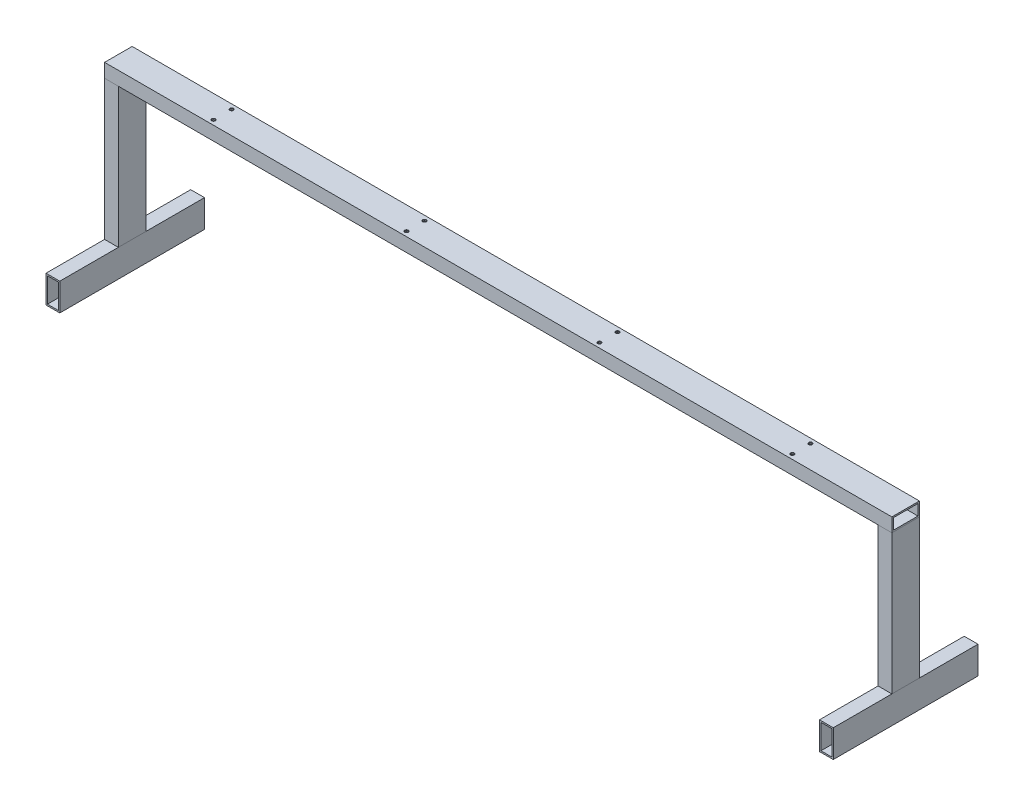
from build123d import *

# Parameters (mm, degrees)
AL_START                                       = -544.05
AL_TUBE_RECTANGULAR_AL_TUBE_3_X_1_5_2_W        = 192.85
AL_TUBE_RECTANGULAR_AL_TUBE_3_X_1_5_2_H        = 38.1
AL_TUBE_RECTANGULAR_AL_TUBE_3_X_1_5_RECT_DEPTH = 2.032
AL_START_2                                     = -527.032
AL_TUBE_RECTANGULAR_AL_TUBE_3_X_1_5_3_OU_W     = 192.85
AL_TUBE_RECTANGULAR_AL_TUBE_3_X_1_5_3_OU_H     = 38.1
AL_TUBE_RECTANGULAR_AL_TUBE_3_X_1_5_3_DEPTH    = 2.032
AL_START_3                                     = -542.018
AL_TUBE_RECTANGULAR_AL_TUBE_3_X_1_5_4_OU_W     = 192.85
AL_TUBE_RECTANGULAR_AL_TUBE_3_X_1_5_4_OU_H     = 2.032
AL_TUBE_RECTANGULAR_AL_TUBE_3_X_1_5_4_DEPTH    = 14.986
AL_START_4                                     = -19.05
AL_TUBE_RECTANGULAR_AL_TUBE_3_X_1_5_5_OU_W     = 1088.1
AL_TUBE_RECTANGULAR_AL_TUBE_3_X_1_5_5_OU_H     = 38.1
AL_TUBE_RECTANGULAR_AL_TUBE_3_X_1_5_5_DEPTH    = 2.032
AL_START_5                                     = -2.032
AL_TUBE_RECTANGULAR_AL_TUBE_3_X_1_5_6_OU_W     = 1088.1
AL_TUBE_RECTANGULAR_AL_TUBE_3_X_1_5_6_OU_H     = 38.1
AL_TUBE_RECTANGULAR_AL_TUBE_3_X_1_5_6_DEPTH    = 2.032
AL_START_6                                     = -17.018
AL_TUBE_RECTANGULAR_AL_TUBE_3_X_1_5_7_OU_W     = 1088.1
AL_TUBE_RECTANGULAR_AL_TUBE_3_X_1_5_7_OU_H     = 2.032
AL_TUBE_RECTANGULAR_AL_TUBE_3_X_1_5_7_DEPTH    = 14.986
AL_START_7                                     = 525
AL_TUBE_RECTANGULAR_AL_TUBE_3_X_1_5_8_OU_W     = 192.85
AL_TUBE_RECTANGULAR_AL_TUBE_3_X_1_5_8_OU_H     = 38.1
AL_TUBE_RECTANGULAR_AL_TUBE_3_X_1_5_8_DEPTH    = 2.032
AL_START_8                                     = 542.018
AL_TUBE_RECTANGULAR_AL_TUBE_3_X_1_5_9_OU_W     = 192.85
AL_TUBE_RECTANGULAR_AL_TUBE_3_X_1_5_9_OU_H     = 38.1
AL_TUBE_RECTANGULAR_AL_TUBE_3_X_1_5_9_DEPTH    = 2.032
AL_START_9                                     = 527.032
AL_TUBE_RECTANGULAR_AL_TUBE_3_X_1_5_10_O_W     = 192.85
AL_TUBE_RECTANGULAR_AL_TUBE_3_X_1_5_10_O_H     = 2.032
AL_TUBE_RECTANGULAR_AL_TUBE_3_X_1_5_10_DEPTH   = 14.986
AL_TUBE_RECTANGULAR_AL_TUBE_3_X_1_5_11_O_W     = 38.1
AL_TUBE_RECTANGULAR_AL_TUBE_3_X_1_5_11_O_H     = 200
AL_TUBE_RECTANGULAR_AL_TUBE_3_X_1_5_11_DEPTH   = 2.032
AL_TUBE_RECTANGULAR_AL_TUBE_3_X_1_5_12_O_W     = 38.1
AL_TUBE_RECTANGULAR_AL_TUBE_3_X_1_5_12_O_H     = 200
AL_TUBE_RECTANGULAR_AL_TUBE_3_X_1_5_12_DEPTH   = 2.032
AL_TUBE_RECTANGULAR_AL_TUBE_3_X_1_5_13_O_W     = 2.032
AL_TUBE_RECTANGULAR_AL_TUBE_3_X_1_5_13_O_H     = 200
AL_TUBE_RECTANGULAR_AL_TUBE_3_X_1_5_13_DEPTH   = 14.986
AL_TUBE_RECTANGULAR_AL_TUBE_3_X_1_5_14_O_W     = 38.1
AL_TUBE_RECTANGULAR_AL_TUBE_3_X_1_5_14_O_H     = 200
AL_TUBE_RECTANGULAR_AL_TUBE_3_X_1_5_14_DEPTH   = 2.032
AL_TUBE_RECTANGULAR_AL_TUBE_3_X_1_5_15_O_W     = 38.1
AL_TUBE_RECTANGULAR_AL_TUBE_3_X_1_5_15_O_H     = 200
AL_TUBE_RECTANGULAR_AL_TUBE_3_X_1_5_15_DEPTH   = 2.032
AL_TUBE_RECTANGULAR_AL_TUBE_3_X_1_5_16_O_W     = 2.032
AL_TUBE_RECTANGULAR_AL_TUBE_3_X_1_5_16_O_H     = 200
AL_TUBE_RECTANGULAR_AL_TUBE_3_X_1_5_16_DEPTH   = 14.986
TROU_TARAUD_M5X0_81_AT_2_COUNT                 = 2
TROU_TARAUD_M5X0_81_AT_2_PITCH                 = 800
TROU_TARAUD_M5X0_81_AT_3_COUNT                 = 2
TROU_TARAUD_M5X0_81_AT_3_PITCH                 = 800.390529679
TROU_TARAUD_M5X0_81_AT_4_COUNT                 = 2
TROU_TARAUD_M5X0_81_AT_4_PITCH                 = 533.918949321
TROU_TARAUD_M5X0_81_AT_5_COUNT                 = 2
TROU_TARAUD_M5X0_81_AT_5_PITCH                 = 533.333333333
TROU_TARAUD_M5X0_81_AT_6_COUNT                 = 2
TROU_TARAUD_M5X0_81_AT_6_PITCH                 = 266.666666667
TROU_TARAUD_M5X0_81_AT_7_COUNT                 = 2
TROU_TARAUD_M5X0_81_AT_7_PITCH                 = 267.835978
TROU_TARAUD_M5X0_81_AT_8_COUNT                 = 2
TROU_TARAUD_M5X0_81_AT_8_PITCH                 = 25


# Read off the part's stored shape, not the designer's step: Al tube rectangular AL TUBE 3 X 1.5 RECT X 0.104 WALL(4)
with BuildPart() as part:
    # Al tube rectangular AL TUBE 3 X 1.5  2 → Al tube rectangular AL TUBE 3 X 1.5 RECT X 0.104 WALL(4) (new body)
    with BuildSketch(Plane.YZ.offset(AL_START)):
        with Locations((-115.475, 0)):
            Rectangle(AL_TUBE_RECTANGULAR_AL_TUBE_3_X_1_5_2_W, AL_TUBE_RECTANGULAR_AL_TUBE_3_X_1_5_2_H)
    extrude(amount=AL_TUBE_RECTANGULAR_AL_TUBE_3_X_1_5_RECT_DEPTH)

    # Al tube rectangular AL TUBE 3 X 1.5 3 ou → Al tube rectangular AL TUBE 3 X 1.5  3 (add)
    with BuildSketch(Plane.YZ.offset(AL_START_2)):
        with Locations((-115.475, 0)):
            Rectangle(AL_TUBE_RECTANGULAR_AL_TUBE_3_X_1_5_3_OU_W, AL_TUBE_RECTANGULAR_AL_TUBE_3_X_1_5_3_OU_H)
    extrude(amount=AL_TUBE_RECTANGULAR_AL_TUBE_3_X_1_5_3_DEPTH)

    # Al tube rectangular AL TUBE 3 X 1.5 4 ou → Al tube rectangular AL TUBE 3 X 1.5  4 (add)
    with BuildSketch(Plane.YZ.offset(AL_START_3)):
        with Locations((-115.475, 18.034)):
            Rectangle(AL_TUBE_RECTANGULAR_AL_TUBE_3_X_1_5_4_OU_W, AL_TUBE_RECTANGULAR_AL_TUBE_3_X_1_5_4_OU_H)
        with Locations((-115.475, -18.034)):
            Rectangle(AL_TUBE_RECTANGULAR_AL_TUBE_3_X_1_5_4_OU_W, AL_TUBE_RECTANGULAR_AL_TUBE_3_X_1_5_4_OU_H)
    extrude(amount=AL_TUBE_RECTANGULAR_AL_TUBE_3_X_1_5_4_DEPTH)


with BuildPart() as body_2:
    # Al tube rectangular AL TUBE 3 X 1.5 5 ou → Al tube rectangular AL TUBE 3 X 1.5  5 (new body)
    with BuildSketch(Plane(origin=(0, 0, 0), x_dir=(1, 0, 0), z_dir=(0, 1, 0)).offset(AL_START_4)):
        Rectangle(AL_TUBE_RECTANGULAR_AL_TUBE_3_X_1_5_5_OU_W, AL_TUBE_RECTANGULAR_AL_TUBE_3_X_1_5_5_OU_H)
    extrude(amount=AL_TUBE_RECTANGULAR_AL_TUBE_3_X_1_5_5_DEPTH)

    # Al tube rectangular AL TUBE 3 X 1.5 6 ou → Al tube rectangular AL TUBE 3 X 1.5  6 (add)
    with BuildSketch(Plane(origin=(0, 0, 0), x_dir=(1, 0, 0), z_dir=(0, 1, 0)).offset(AL_START_5)):
        Rectangle(AL_TUBE_RECTANGULAR_AL_TUBE_3_X_1_5_6_OU_W, AL_TUBE_RECTANGULAR_AL_TUBE_3_X_1_5_6_OU_H)
    extrude(amount=AL_TUBE_RECTANGULAR_AL_TUBE_3_X_1_5_6_DEPTH)

    # Al tube rectangular AL TUBE 3 X 1.5 7 ou → Al tube rectangular AL TUBE 3 X 1.5  7 (add)
    with BuildSketch(Plane(origin=(0, 0, 0), x_dir=(1, 0, 0), z_dir=(0, 1, 0)).offset(AL_START_6)):
        with Locations((0, 18.034)):
            Rectangle(AL_TUBE_RECTANGULAR_AL_TUBE_3_X_1_5_7_OU_W, AL_TUBE_RECTANGULAR_AL_TUBE_3_X_1_5_7_OU_H)
        with Locations((0, -18.034)):
            Rectangle(AL_TUBE_RECTANGULAR_AL_TUBE_3_X_1_5_7_OU_W, AL_TUBE_RECTANGULAR_AL_TUBE_3_X_1_5_7_OU_H)
    extrude(amount=AL_TUBE_RECTANGULAR_AL_TUBE_3_X_1_5_7_DEPTH)

    # Esquisse2 → Trou taraudé M5x0.81 (revolve, cut)
    with BuildSketch(Plane(origin=(400, 0, -12.5), x_dir=(0, 0, 1), z_dir=(1, 0, 0))):
        Polygon((0, 0), (0, 2.033), (2.1, 2.033), (2.1, 0.425), (2.525, 0), align=None)
    trou_taraud_m5x0_81 = revolve(axis=Axis((400, 6.35, -12.5), (0, -1, 0)), mode=Mode.SUBTRACT)

    # Trou taraudé M5x0.81 at 2: Trou taraudé M5x0.81 ×2
    with Locations(*[(-i * TROU_TARAUD_M5X0_81_AT_2_PITCH, 0, 0) for i in range(1, TROU_TARAUD_M5X0_81_AT_2_COUNT)]):
        add(trou_taraud_m5x0_81, mode=Mode.SUBTRACT)

    # Trou taraudé M5x0.81 at 3: Trou taraudé M5x0.81 ×2
    with Locations(*[Vector(-0.9995120760870788, 0, 0.031234752377721213) * (i * TROU_TARAUD_M5X0_81_AT_3_PITCH) for i in range(1, TROU_TARAUD_M5X0_81_AT_3_COUNT)]):
        add(trou_taraud_m5x0_81, mode=Mode.SUBTRACT)

    # Trou taraudé M5x0.81 at 4: Trou taraudé M5x0.81 ×2
    with Locations(*[Vector(-0.998903174369838, 0, 0.04682358629858615) * (i * TROU_TARAUD_M5X0_81_AT_4_PITCH) for i in range(1, TROU_TARAUD_M5X0_81_AT_4_COUNT)]):
        add(trou_taraud_m5x0_81, mode=Mode.SUBTRACT)

    # Trou taraudé M5x0.81 at 5: Trou taraudé M5x0.81 ×2
    with Locations(*[(-i * TROU_TARAUD_M5X0_81_AT_5_PITCH, 0, 0) for i in range(1, TROU_TARAUD_M5X0_81_AT_5_COUNT)]):
        add(trou_taraud_m5x0_81, mode=Mode.SUBTRACT)

    # Trou taraudé M5x0.81 at 6: Trou taraudé M5x0.81 ×2
    with Locations(*[(-i * TROU_TARAUD_M5X0_81_AT_6_PITCH, 0, 0) for i in range(1, TROU_TARAUD_M5X0_81_AT_6_COUNT)]):
        add(trou_taraud_m5x0_81, mode=Mode.SUBTRACT)

    # Trou taraudé M5x0.81 at 7: Trou taraudé M5x0.81 ×2
    with Locations(*[Vector(-0.9956342260592882, 0, 0.09334070869305829) * (i * TROU_TARAUD_M5X0_81_AT_7_PITCH) for i in range(1, TROU_TARAUD_M5X0_81_AT_7_COUNT)]):
        add(trou_taraud_m5x0_81, mode=Mode.SUBTRACT)

    # Trou taraudé M5x0.81 at 8: Trou taraudé M5x0.81 ×2
    with Locations(*[(0, 0, i * TROU_TARAUD_M5X0_81_AT_8_PITCH) for i in range(1, TROU_TARAUD_M5X0_81_AT_8_COUNT)]):
        add(trou_taraud_m5x0_81, mode=Mode.SUBTRACT)


with BuildPart() as body_3:
    # Al tube rectangular AL TUBE 3 X 1.5 8 ou → Al tube rectangular AL TUBE 3 X 1.5  8 (new body)
    with BuildSketch(Plane.YZ.offset(AL_START_7)):
        with Locations((-115.475, 0)):
            Rectangle(AL_TUBE_RECTANGULAR_AL_TUBE_3_X_1_5_8_OU_W, AL_TUBE_RECTANGULAR_AL_TUBE_3_X_1_5_8_OU_H)
    extrude(amount=AL_TUBE_RECTANGULAR_AL_TUBE_3_X_1_5_8_DEPTH)

    # Al tube rectangular AL TUBE 3 X 1.5 9 ou → Al tube rectangular AL TUBE 3 X 1.5  9 (add)
    with BuildSketch(Plane.YZ.offset(AL_START_8)):
        with Locations((-115.475, 0)):
            Rectangle(AL_TUBE_RECTANGULAR_AL_TUBE_3_X_1_5_9_OU_W, AL_TUBE_RECTANGULAR_AL_TUBE_3_X_1_5_9_OU_H)
    extrude(amount=AL_TUBE_RECTANGULAR_AL_TUBE_3_X_1_5_9_DEPTH)

    # Al tube rectangular AL TUBE 3 X 1.5 10 o → Al tube rectangular AL TUBE 3 X 1.5  10 (add)
    with BuildSketch(Plane.YZ.offset(AL_START_9)):
        with Locations((-115.475, 18.034)):
            Rectangle(AL_TUBE_RECTANGULAR_AL_TUBE_3_X_1_5_10_O_W, AL_TUBE_RECTANGULAR_AL_TUBE_3_X_1_5_10_O_H)
        with Locations((-115.475, -18.034)):
            Rectangle(AL_TUBE_RECTANGULAR_AL_TUBE_3_X_1_5_10_O_W, AL_TUBE_RECTANGULAR_AL_TUBE_3_X_1_5_10_O_H)
    extrude(amount=AL_TUBE_RECTANGULAR_AL_TUBE_3_X_1_5_10_DEPTH)


with BuildPart() as body_4:
    # Al tube rectangular AL TUBE 3 X 1.5 11 o → Al tube rectangular AL TUBE 3 X 1.5  11 (new body)
    with BuildSketch(Plane.YZ.offset(AL_START_7)):
        with Locations((-230.95, 0)):
            Rectangle(AL_TUBE_RECTANGULAR_AL_TUBE_3_X_1_5_11_O_W, AL_TUBE_RECTANGULAR_AL_TUBE_3_X_1_5_11_O_H)
    extrude(amount=AL_TUBE_RECTANGULAR_AL_TUBE_3_X_1_5_11_DEPTH)

    # Al tube rectangular AL TUBE 3 X 1.5 12 o → Al tube rectangular AL TUBE 3 X 1.5  12 (add)
    with BuildSketch(Plane.YZ.offset(AL_START_8)):
        with Locations((-230.95, 0)):
            Rectangle(AL_TUBE_RECTANGULAR_AL_TUBE_3_X_1_5_12_O_W, AL_TUBE_RECTANGULAR_AL_TUBE_3_X_1_5_12_O_H)
    extrude(amount=AL_TUBE_RECTANGULAR_AL_TUBE_3_X_1_5_12_DEPTH)

    # Al tube rectangular AL TUBE 3 X 1.5 13 o → Al tube rectangular AL TUBE 3 X 1.5  13 (add)
    with BuildSketch(Plane.YZ.offset(AL_START_9)):
        with Locations((-248.984, 0)):
            Rectangle(AL_TUBE_RECTANGULAR_AL_TUBE_3_X_1_5_13_O_W, AL_TUBE_RECTANGULAR_AL_TUBE_3_X_1_5_13_O_H)
        with Locations((-212.916, 0)):
            Rectangle(AL_TUBE_RECTANGULAR_AL_TUBE_3_X_1_5_13_O_W, AL_TUBE_RECTANGULAR_AL_TUBE_3_X_1_5_13_O_H)
    extrude(amount=AL_TUBE_RECTANGULAR_AL_TUBE_3_X_1_5_13_DEPTH)


with BuildPart() as body_5:
    # Al tube rectangular AL TUBE 3 X 1.5 14 o → Al tube rectangular AL TUBE 3 X 1.5  14 (new body)
    with BuildSketch(Plane.YZ.offset(AL_START)):
        with Locations((-230.95, 0)):
            Rectangle(AL_TUBE_RECTANGULAR_AL_TUBE_3_X_1_5_14_O_W, AL_TUBE_RECTANGULAR_AL_TUBE_3_X_1_5_14_O_H)
    extrude(amount=AL_TUBE_RECTANGULAR_AL_TUBE_3_X_1_5_14_DEPTH)

    # Al tube rectangular AL TUBE 3 X 1.5 15 o → Al tube rectangular AL TUBE 3 X 1.5  15 (add)
    with BuildSketch(Plane.YZ.offset(AL_START_2)):
        with Locations((-230.95, 0)):
            Rectangle(AL_TUBE_RECTANGULAR_AL_TUBE_3_X_1_5_15_O_W, AL_TUBE_RECTANGULAR_AL_TUBE_3_X_1_5_15_O_H)
    extrude(amount=AL_TUBE_RECTANGULAR_AL_TUBE_3_X_1_5_15_DEPTH)

    # Al tube rectangular AL TUBE 3 X 1.5 16 o → Al tube rectangular AL TUBE 3 X 1.5  16 (add)
    with BuildSketch(Plane.YZ.offset(AL_START_3)):
        with Locations((-248.984, 0)):
            Rectangle(AL_TUBE_RECTANGULAR_AL_TUBE_3_X_1_5_16_O_W, AL_TUBE_RECTANGULAR_AL_TUBE_3_X_1_5_16_O_H)
        with Locations((-212.916, 0)):
            Rectangle(AL_TUBE_RECTANGULAR_AL_TUBE_3_X_1_5_16_O_W, AL_TUBE_RECTANGULAR_AL_TUBE_3_X_1_5_16_O_H)
    extrude(amount=AL_TUBE_RECTANGULAR_AL_TUBE_3_X_1_5_16_DEPTH)


solid = Compound([part.part, body_2.part, body_3.part, body_4.part, body_5.part])
